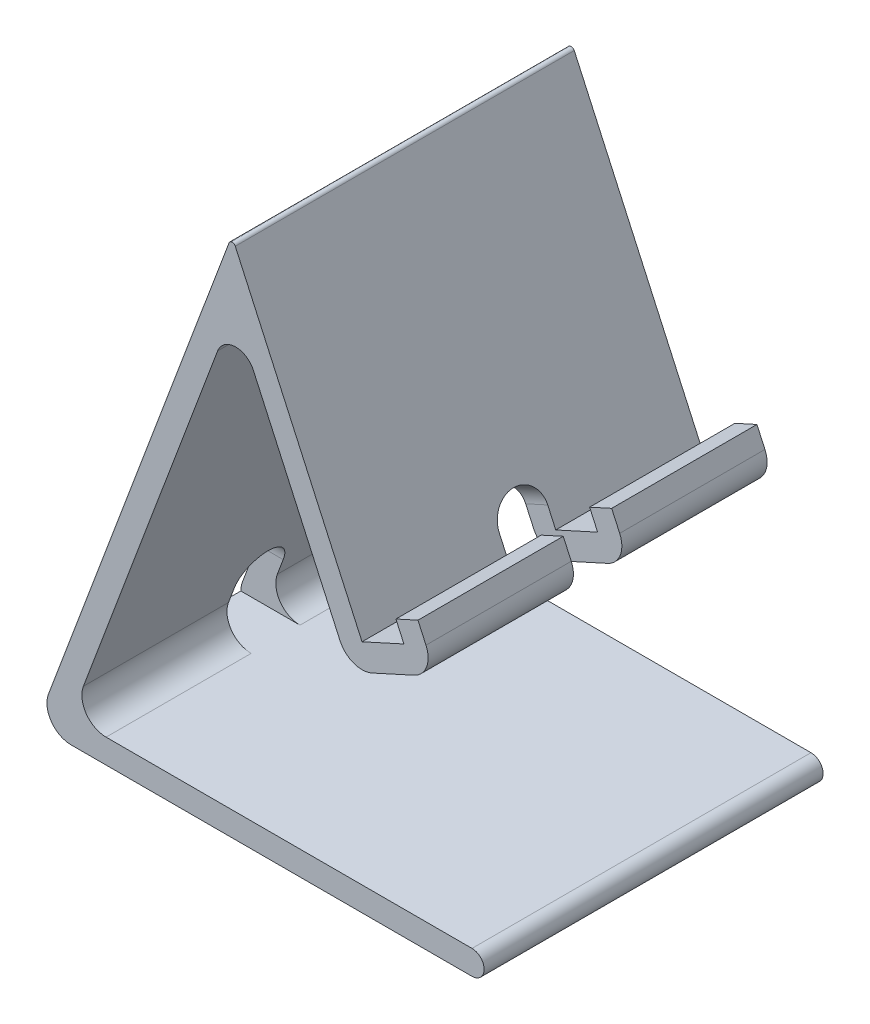
from build123d import *

# Parameters (mm, degrees)
BOSS_EXTRUDE1_DEPTH     = 70
CUT_EXTRUDE1_DEPTH      = 70
CUT_EXTRUDE1_DEPTH_BACK = 40
CUT_EXTRUDE2_DEPTH      = 122


with BuildPart() as part:
    # Sketch1 → Boss-Extrude1 (new body)
    with BuildSketch(Plane.XY):
        with BuildLine():
            Line((7.217620672, 0), (90, 0))
            ThreePointArc((90, 0), (92.5, 2.5), (90, 5))
            Line((90, 5), (14.435241344, 5))
            ThreePointArc((14.435241344, 5), (10.32512957, 7.152723896), (9.754192129, 11.757207515))
            Line((9.754192129, 11.757207515), (37.460728477, 85.565029918))
            ThreePointArc((37.460728477, 85.565029918), (41.071238311, 88.157007717), (44.847595843, 85.81323854))
            Line((44.847595843, 85.81323854), (62.740325662, 46.413708737))
            ThreePointArc((62.740325662, 46.413708737), (65.535653139, 43.800127815), (69.360328947, 43.928642037))
            Line((69.360328947, 43.928642037), (78.010145433, 47.856831793))
            ThreePointArc((78.010145433, 47.856831793), (80.623726355, 50.65215927), (80.495212133, 54.476835078))
            Line((80.495212133, 54.476835078), (78.841237499, 58.118863072))
            Line((78.841237499, 58.118863072), (74.288702506, 56.05139478))
            Line((74.288702506, 56.05139478), (75.942677141, 52.409366786))
            Line((75.942677141, 52.409366786), (67.292860655, 48.48117703))
            Line((67.292860655, 48.48117703), (41.114556249, 106.125421092))
            ThreePointArc((41.114556249, 106.125421092), (40.453693681, 106.535580698), (39.82185446, 106.081984583))
            Line((39.82185446, 106.081984583), (2.536571457, 6.757207515))
            ThreePointArc((2.536571457, 6.757207515), (3.107508899, 2.152723896), (7.217620672, 0))
        make_face()
    extrude(amount=BOSS_EXTRUDE1_DEPTH)

    # Sketch3 → Cut-Extrude1 (cut, two sides: drawn at the far end of the back side and taken through both)
    with BuildSketch(Plane(origin=(74.039952392, 33.624179542, 0), x_dir=(0, 0, -1), z_dir=(0.9105069985186094, 0.4134936585349684, 0)).offset(-CUT_EXTRUDE1_DEPTH_BACK)):
        with BuildLine():
            ThreePointArc((-30, 20.317279836), (-35, 25.317279836), (-40, 20.317279836))
            Line((-40, 20.317279836), (-40, 10.317279836))
            Line((-40, 10.317279836), (-30, 10.317279836))
            Line((-30, 10.317279836), (-30, 20.317279836))
        make_face()
    extrude(amount=CUT_EXTRUDE1_DEPTH + CUT_EXTRUDE1_DEPTH_BACK, mode=Mode.SUBTRACT)

    # Sketch7 → Cut-Extrude2 (cut)
    with BuildSketch(Plane(origin=(0, 0, 0), x_dir=(0, 0, -1), z_dir=(1, 0, 0))):
        with BuildLine():
            Line((-29.955104699, 5), (-40.044895301, 5))
            Line((-40.044895301, 5), (-40.044895301, 14.986135184))
            ThreePointArc((-40.044895301, 14.986135184), (-35, 20.031030486), (-29.955104699, 14.986135184))
            Line((-29.955104699, 14.986135184), (-29.955104699, 5))
        make_face()
    extrude(amount=CUT_EXTRUDE2_DEPTH, mode=Mode.SUBTRACT)


solid = part.part
